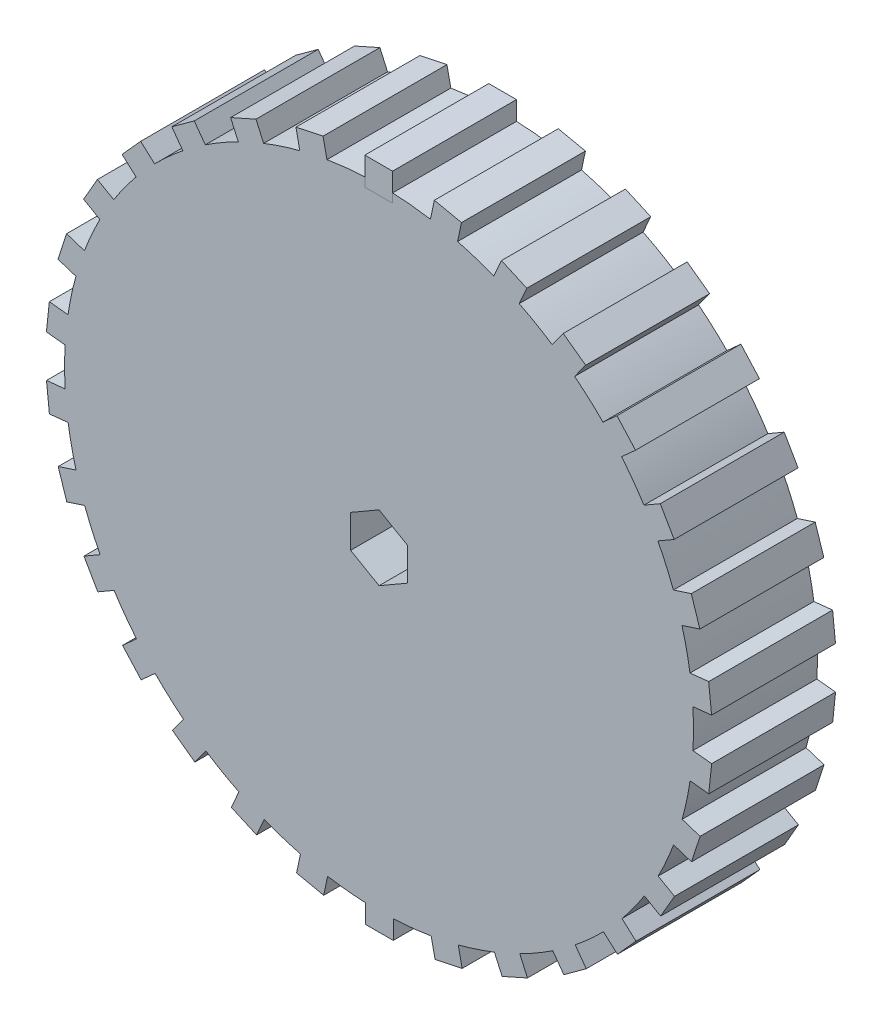
from build123d import *

# Parameters (mm, degrees)
SKETCH1_R           = 34
BOSS_EXTRUDE1_DEPTH = 13.4
CUT_EXTRUDE1_REACH  = 51.916
BOSS_EXTRUDE3_START = 33
SKETCH9_W           = 3
SKETCH9_H           = 13.4
BOSS_EXTRUDE3_DEPTH = 3
CIRPATTERN11_COUNT  = 30
SKETCH12_R          = 29
SKETCH12_R_2        = 7
CUT_EXTRUDE6_DEPTH  = 6.7
SKETCH14_R          = 7.869119163
CUT_EXTRUDE7_DEPTH  = 2
FILLET1_R           = 10


with BuildPart() as part:
    # Sketch1 → Boss-Extrude1 (new body)
    with BuildSketch(Plane.XY):
        Circle(SKETCH1_R)
    extrude(amount=BOSS_EXTRUDE1_DEPTH)

    # Sketch2 → Cut-Extrude1 (cut, up to next)
    with BuildSketch(Plane.XY.offset(13.4), mode=Mode.PRIVATE) as cut_extrude1_sk1:
        Polygon((0, -3.550704156), (3.075, -1.775352078), (3.075, 1.775352078), (0, 3.550704156), (-3.075, 1.775352078), (-3.075, -1.775352078), align=None)
    cut_extrude1_tool1 = extrude(cut_extrude1_sk1.sketch, amount=-CUT_EXTRUDE1_REACH, mode=Mode.PRIVATE) & part.part
    add(cut_extrude1_tool1.solids().sort_by_distance((0, 0, 13.4))[0], mode=Mode.SUBTRACT)


with BuildPart() as body_2:
    # Sketch9 → Boss-Extrude3 (new body)
    with BuildSketch(Plane(origin=(0, 0, 0), x_dir=(1, 0, 0), z_dir=(0, 1, 0)).offset(BOSS_EXTRUDE3_START)):
        with Locations((-0.0375, -6.7)):
            Rectangle(SKETCH9_W, SKETCH9_H)
    boss_extrude3 = extrude(amount=BOSS_EXTRUDE3_DEPTH)


with BuildPart() as part_1:
    add(part.part)

    # CirPattern11: Boss-Extrude3 ×30 about axis
    cirpattern11_axis = Axis((0, 0, 0), (0, 0, 1))
    for i in range(1, CIRPATTERN11_COUNT):
        add(boss_extrude3.rotate(cirpattern11_axis, i * 360 / CIRPATTERN11_COUNT))

    # Sketch12 → Cut-Extrude6 (cut)
    with BuildSketch(Plane(origin=(0, 0, 0), x_dir=(-1, 0, 0), z_dir=(0, 0, -1))):
        Circle(SKETCH12_R)
        Circle(SKETCH12_R_2, mode=Mode.SUBTRACT)
    extrude(amount=-CUT_EXTRUDE6_DEPTH, mode=Mode.SUBTRACT)

    # Sketch14 → Cut-Extrude7 (cut)
    with BuildSketch(Plane(origin=(0, 0, 0), x_dir=(-1, 0, 0), z_dir=(0, 0, -1))):
        Circle(SKETCH14_R)
    extrude(amount=-CUT_EXTRUDE7_DEPTH, mode=Mode.SUBTRACT)

    # Fillet1
    # the kernel refuses this fillet: 10 mm, written as the material it adds along each edge
    with BuildSketch(Plane(origin=(0, 0, 6.7), x_dir=(-1, 0, 0), z_dir=(0, -1, 0))) as fillet1_piece_1:
        with BuildLine():
            CenterArc((19.56019068, 10), FILLET1_R, 270, 70.731224509)
            Line((19.56019068, 0), (19.56019068, -0.2))
            Line((19.56019068, -0.2), (29, -0.2))
            Line((29, -0.2), (29.2, 0))
            ThreePointArc((29.2, 0), (29.2, 3.35), (29.188796186, 6.634))
            Line((29.188796186, 6.634), (29, 6.7))
        make_face()
    revolve(axis=Axis((0, 0, 6.7), (0, 0, -1)))


solid = Compound([body_2.part, part_1.part])
